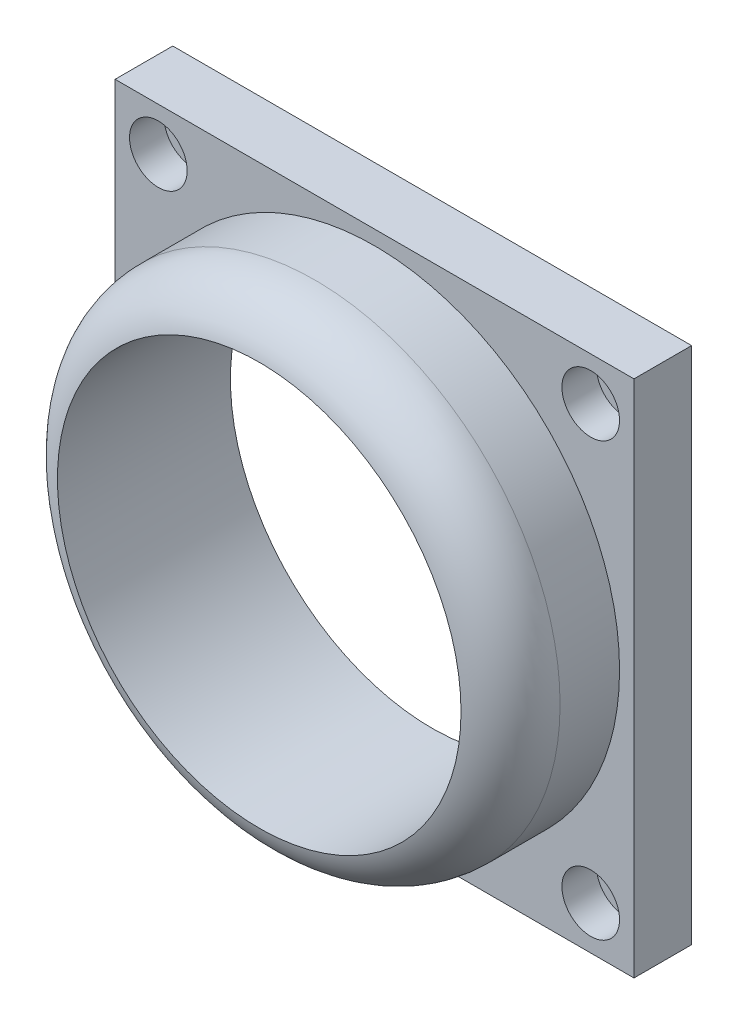
from build123d import *

# Parameters (mm, degrees)
SKETCH_1_W          = 90
SKETCH_1_H          = 90
EXTRUDE_3_DEPTH     = 10
SKETCH_3_R          = 35
CUT_EXTRUDE_2_DEPTH = 10
EXTRUDE_START       = 20
SKETCH_4_R          = 42.5
SKETCH_4_R_2        = 35
EXTRUDE_4_DEPTH     = 20
FILLET_1_R          = 10
SKETCH_5_R          = 3
CUT_EXTRUDE_3_DEPTH = 10
SKETCH_6_R          = 5
CUT_EXTRUDE_4_DEPTH = 6


with BuildPart() as part:
    # 스케치1 → 보스-돌출3 (new body)
    with BuildSketch(Plane.XY):
        with Locations((-47.732849402, 28.135926797)):
            Rectangle(SKETCH_1_W, SKETCH_1_H)
    extrude(amount=EXTRUDE_3_DEPTH)

    # 스케치3 → 컷-돌출2 (cut)
    with BuildSketch(Plane.XY.offset(10)):
        with Locations((-47.732849402, 28.135926797)):
            Circle(SKETCH_3_R)
    extrude(amount=-CUT_EXTRUDE_2_DEPTH, mode=Mode.SUBTRACT)

    # 스케치4 → 보스-돌출4 (add)
    with BuildSketch(Plane.XY.offset(10).offset(EXTRUDE_START)):
        with Locations((-47.732849402, 28.135926797)):
            Circle(SKETCH_4_R)
        with Locations((-47.732849402, 28.135926797)):
            Circle(SKETCH_4_R_2, mode=Mode.SUBTRACT)
    extrude(amount=-EXTRUDE_4_DEPTH)

    # 필렛1
    # the kernel refuses this fillet: 10 mm, written as the material it takes off along each edge
    with BuildSketch(Plane(origin=(-47.732849402, 28.135926797, 30), x_dir=(1, 0, 0), z_dir=(0, -1, 0))) as fillet_1_piece_1:
        with BuildLine():
            CenterArc((32.5, -9.682458366), FILLET_1_R, 0, 75.522487814)
            Line((35, 0), (35.05, 0.193649167))
            ThreePointArc((35.05, 0.193649167), (38.75, 0.2), (42.5, 0.2))
            Line((42.5, 0.2), (42.7, 0))
            Line((42.7, 0), (42.7, -9.682458366))
            Line((42.7, -9.682458366), (42.5, -9.682458366))
        make_face()
    revolve(axis=Axis((-47.732849402, 28.135926797, 30), (0, 0, 1)), mode=Mode.SUBTRACT)

    # 스케치5 → 컷-돌출3 (cut)
    with BuildSketch(Plane.XY.offset(10)):
        with Locations((-85.232849402, 65.635926797)):
            Circle(SKETCH_5_R)
        with Locations(Location((-10.232849402, 65.635926797, 0), (0, 0, 180))):
            Circle(SKETCH_5_R)
        with Locations((-10.232849402, -9.364073203)):
            Circle(SKETCH_5_R)
        with Locations(Location((-85.232849402, -9.364073203, 0), (0, 0, 180))):
            Circle(SKETCH_5_R)
    extrude(amount=-CUT_EXTRUDE_3_DEPTH, mode=Mode.SUBTRACT)

    # 스케치6 → 컷-돌출4 (cut)
    with BuildSketch(Plane.XY.offset(10)):
        with Locations((-85.232849402, 65.635926797)):
            Circle(SKETCH_6_R)
        with Locations(Location((-10.232849402, 65.635926797, 0), (0, 0, 180))):
            Circle(SKETCH_6_R)
        with Locations((-10.232849402, -9.364073203)):
            Circle(SKETCH_6_R)
        with Locations(Location((-85.232849402, -9.364073203, 0), (0, 0, 180))):
            Circle(SKETCH_6_R)
    extrude(amount=-CUT_EXTRUDE_4_DEPTH, mode=Mode.SUBTRACT)


solid = part.part
